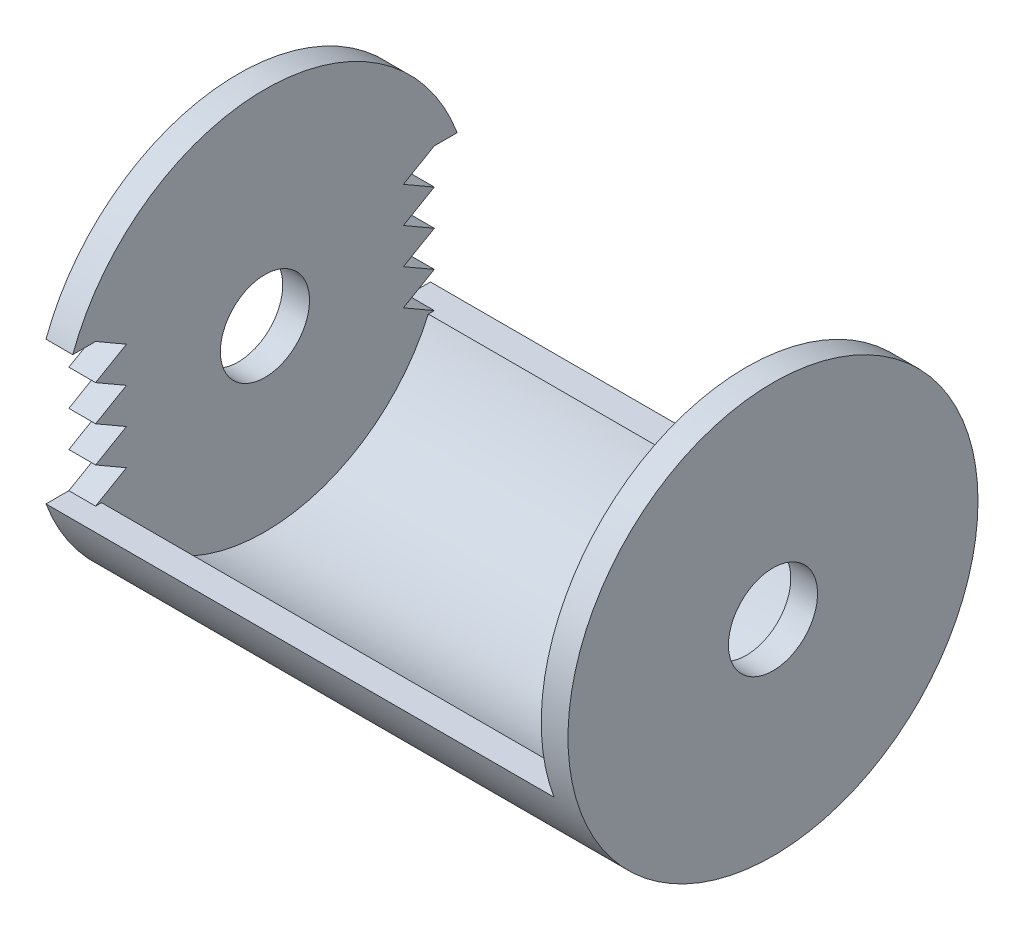
from build123d import *

# Parameters (mm, degrees)
SKETCH3_R               = 29.21
SKETCH3_R_2             = 6.35
BOSS_EXTRUDE1_DEPTH     = 76.2
CUT_EXTRUDE1_DEPTH      = 87.676918496
CUT_EXTRUDE1_DEPTH_BACK = 87.676918496
SKETCH4_W               = 68.58
SKETCH4_H               = 78.74
SHELL4_START            = 3.81
SHELL4_DEPTH            = 68.58
CUT_EXTRUDE2_DEPTH      = 3.81


# Read off the part's stored shape, not the designer's step: Shell4
with BuildPart() as part:
    # Sketch3 → Boss-Extrude1 (new body)
    with BuildSketch(Plane(origin=(0, 0, 0), x_dir=(0, 0, -1), z_dir=(1, 0, 0))):
        with Locations(Location((0, 0, 0), (0, 0, 180))):
            Circle(SKETCH3_R)
        with Locations(Location((0, 0, 0), (0, 0, 180))):
            Circle(SKETCH3_R_2, mode=Mode.SUBTRACT)
    extrude(amount=BOSS_EXTRUDE1_DEPTH)

    # Sketch4 → Cut-Extrude1 (cut, two sides: drawn at the far end of the back side and taken through both)
    with BuildSketch(Plane.XY.offset(-CUT_EXTRUDE1_DEPTH_BACK)):
        with Locations((38.1, 29.21)):
            Rectangle(SKETCH4_W, SKETCH4_H)
    extrude(amount=CUT_EXTRUDE1_DEPTH + CUT_EXTRUDE1_DEPTH_BACK, mode=Mode.SUBTRACT)

    # Shell4 outline → Shell4 (cut)
    with BuildSketch(Plane.YZ.offset(SHELL4_START)):
        with BuildLine():
            ThreePointArc((-10.16, 23.27948453), (-25.4, 0), (-10.16, -23.27948453))
            Line((-10.16, -23.27948453), (-10.16, 23.27948453))
        make_face()
    extrude(amount=SHELL4_DEPTH, mode=Mode.SUBTRACT)

    # Sketch5 → Cut-Extrude2 (cut)
    with BuildSketch(Plane.ZY):
        Polygon((24.13, 10.16), (19.730590949, 7.62), (24.13, 5.08), (19.730590949, 2.54), (24.13, 0), (19.730590949, -2.54), (24.13, -5.08), (19.730590949, -7.62), (24.13, -10.16), (29.21, -10.16), (29.21, 10.16), align=None)
        Polygon((-29.21, 10.16), (-24.13, 10.16), (-19.730590949, 7.62), (-24.13, 5.08), (-19.730590949, 2.54), (-24.13, 0), (-19.730590949, -2.54), (-24.13, -5.08), (-19.730590949, -7.62), (-24.13, -10.16), (-29.21, -10.16), align=None)
    extrude(amount=-CUT_EXTRUDE2_DEPTH, mode=Mode.SUBTRACT)


solid = part.part
